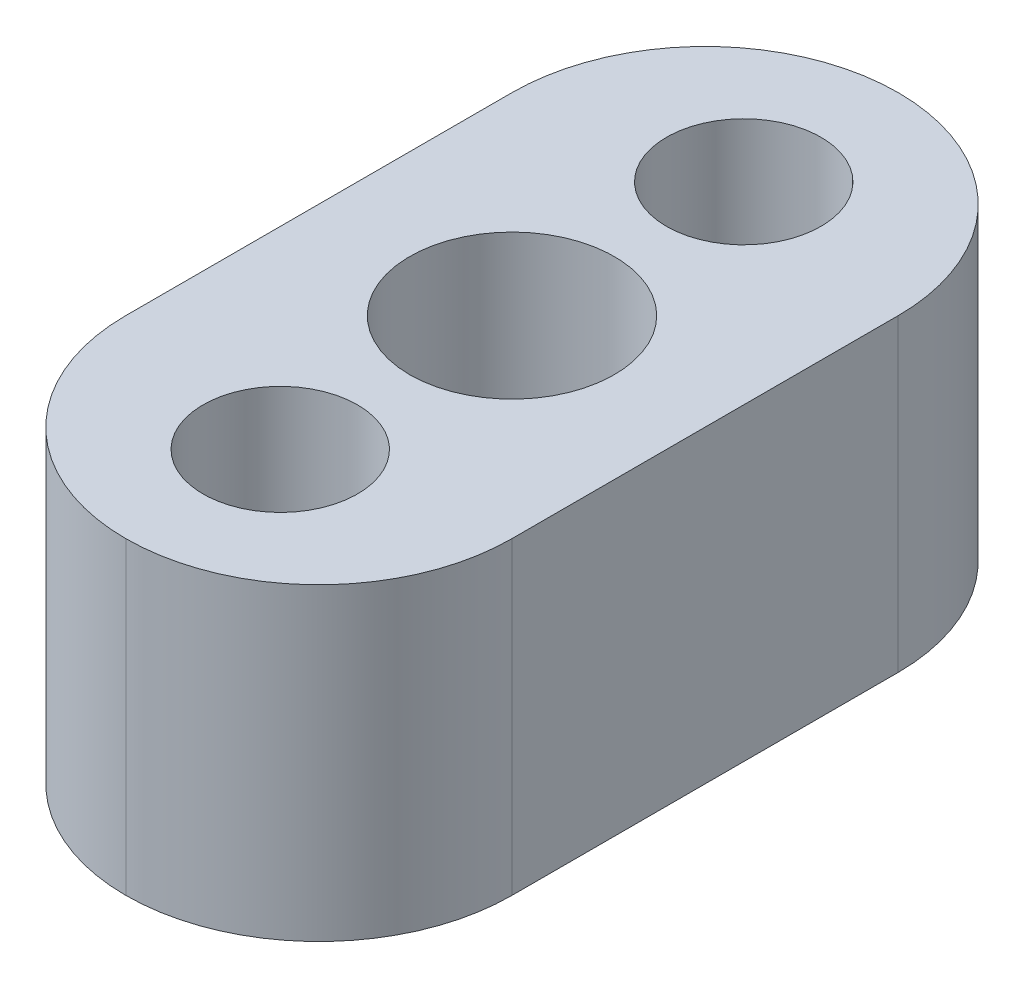
from build123d import *

# Parameters (mm, degrees)
ESQUISSE1_W             = 10
ESQUISSE1_H             = 20
ESQUISSE1_R             = 2
BOSS_EXTRU_1_DEPTH      = 8
ESQUISSE2_R             = 2.65
ENL_V_MAT_EXTRU_1_DEPTH = 5
CONG_1_R                = 5


with BuildPart() as part:
    # Esquisse1 → Boss.-Extru.1 (new body)
    with BuildSketch(Plane(origin=(0, 0, 0), x_dir=(1, 0, 0), z_dir=(0, 1, 0))):
        with Locations((5, 10)):
            Rectangle(ESQUISSE1_W, ESQUISSE1_H)
        with Locations(Location((5, 16, 0), (0, 0, 270))):
            Circle(ESQUISSE1_R, mode=Mode.SUBTRACT)
        with Locations(Location((5, 4, 0), (0, 0, 90))):
            Circle(ESQUISSE1_R, mode=Mode.SUBTRACT)
    extrude(amount=BOSS_EXTRU_1_DEPTH)

    # Esquisse2 → Enlèv. mat.-Extru.1 (cut)
    with BuildSketch(Plane(origin=(0, 8, 0), x_dir=(1, 0, 0), z_dir=(0, 1, 0))):
        with Locations(Location((5, 10, 0), (0, 0, 270))):
            Circle(ESQUISSE2_R)
    extrude(amount=-ENL_V_MAT_EXTRU_1_DEPTH, mode=Mode.SUBTRACT)

    # Congé1
    cong_1_edges = [part.edges().sort_by_distance(p)[0] for p in [
        (0, 4, 0),
        (10, 4, 0),
        (0, 4, -20),
        (10, 4, -20),
    ]]
    fillet(cong_1_edges, radius=CONG_1_R - 0.0001)  # a hair under: the kernel refuses the full size


solid = part.part
